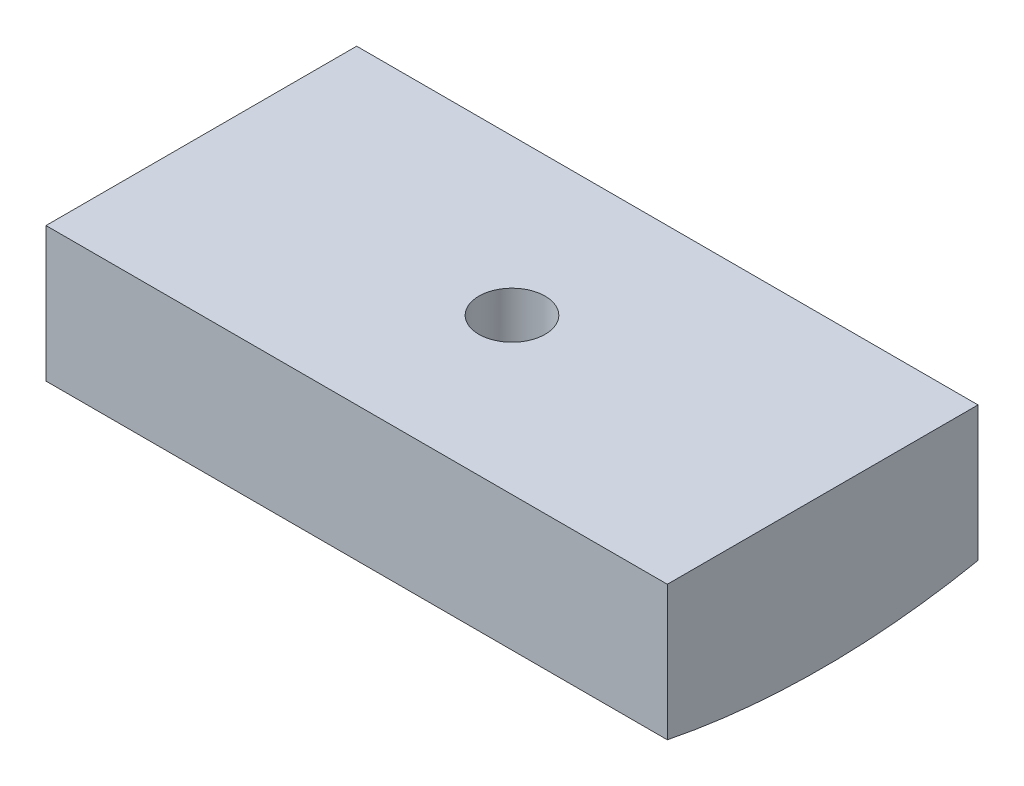
from build123d import *

# Parameters (mm, degrees)
BOSS_EXTRUDE1_DEPTH = 60
SKETCH2_R           = 3.2
CUT_EXTRUDE1_DEPTH  = 64.523617655


with BuildPart() as part:
    # Sketch1 → Boss-Extrude1 (new body)
    with BuildSketch(Plane(origin=(0, 0, 0), x_dir=(0, 0, -1), z_dir=(1, 0, 0))):
        with BuildLine():
            Line((-15, -61.79), (15, -61.79))
            Line((15, -61.79), (15, -74.800829541))
            ThreePointArc((15, -74.800829541), (0, -76.29), (-15, -74.800829541))
            Line((-15, -74.800829541), (-15, -61.79))
        make_face()
    extrude(amount=BOSS_EXTRUDE1_DEPTH)

    # Sketch2 → Cut-Extrude1 (cut, through all)
    with BuildSketch(Plane(origin=(0, -61.79, 0), x_dir=(1, 0, 0), z_dir=(0, 1, 0))):
        with Locations((30, 0)):
            Circle(SKETCH2_R)
    extrude(amount=-CUT_EXTRUDE1_DEPTH, mode=Mode.SUBTRACT)


solid = part.part
